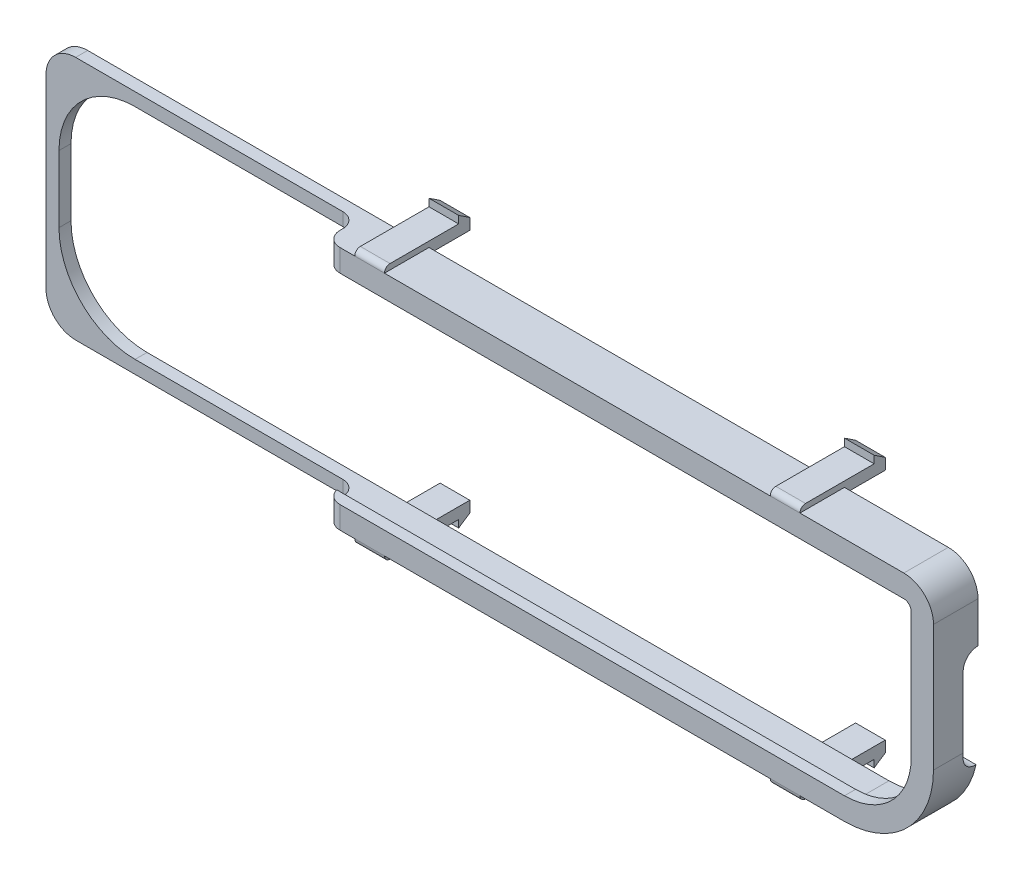
from build123d import *

# Parameters (mm, degrees)
BOSS_EXTRUDE2_THICKNESS_OF_TC_PCB_DEPTH = 4.5
BOSS_EXTRUDE3_RETAINING_TOP_DEPTH       = 1.5
CUT_EXTRUDE1_START                      = -2.881
CUT_EXTRUDE1_EXPOSED_TC_FRONT_DEPTH     = 2.881
FILLET1_R                               = 2
SKETCH7_W                               = 2
SKETCH7_H                               = 14
CUT_EXTRUDE1_USBC_CUTOUT_DEPTH          = 5
FILLET3_R                               = 2
SKETCH8_W                               = 4
SKETCH8_H                               = 1.5
BOSS_EXTRUDE5_SNAP_POSTS_DEPTH          = 5.5
BOSS_EXTRUDE6_SNAP_NOTCH_1_DEPTH        = 4
BOSS_EXTRUDE7_SNAP_NOTCH_2_DEPTH        = 4
SKETCH11_W                              = 4
SKETCH11_H                              = 2.5
BOSS_EXTRUDE1_SNAP_BUMPS_DEPTH          = 6
FILLET6_R                               = 1
FILLET7_R                               = 0.75
BOSS_EXTRUDE1_START                     = -1.619
BOSS_EXTRUDE1_DEPTH                     = 1.619
FILLET8_R                               = 4


with BuildPart() as part:
    # Sketch3 → Boss-Extrude2 - thickness of TC + PCB (new body)
    with BuildSketch(Plane.XY):
        with BuildLine():
            Line((122, -4.5), (122, 12.5))
            ThreePointArc((122, 12.5), (120.828427125, 15.328427125), (118, 16.5))
            Line((118, 16.5), (10, 16.5))
            ThreePointArc((10, 16.5), (1.514718626, 12.985281374), (-2, 4.5))
            Line((-2, 4.5), (-2, -4.5))
            ThreePointArc((-2, -4.5), (1.514718626, -12.985281374), (10, -16.5))
            Line((10, -16.5), (110, -16.5))
            ThreePointArc((110, -16.5), (118.485281374, -12.985281374), (122, -4.5))
        make_face()
        with BuildLine():
            Line((118, 14.75), (10, 14.75))
            ThreePointArc((10, 14.75), (2.752155493, 11.747844507), (-0.25, 4.5))
            Line((-0.25, 4.5), (-0.25, -4.5))
            ThreePointArc((-0.25, -4.5), (2.752155493, -11.747844507), (10, -14.75))
            Line((10, -14.75), (110, -14.75))
            ThreePointArc((110, -14.75), (117.247844507, -11.747844507), (120.25, -4.5))
            Line((120.25, -4.5), (120.25, 12.5))
            ThreePointArc((120.25, 12.5), (119.590990258, 14.090990258), (118, 14.75))
        make_face(mode=Mode.SUBTRACT)
    extrude(amount=BOSS_EXTRUDE2_THICKNESS_OF_TC_PCB_DEPTH)

    # Sketch4 → Boss-Extrude3 - retaining top (add)
    with BuildSketch(Plane.XY.offset(4.5)):
        with BuildLine():
            Line((40, 13.5), (118, 13.5))
            ThreePointArc((118, 13.5), (118.707106781, 13.207106781), (119, 12.5))
            Line((119, 12.5), (119, -4.5))
            ThreePointArc((119, -4.5), (116.363961031, -10.863961031), (110, -13.5))
            Line((110, -13.5), (40, -13.5))
            Line((40, -13.5), (40, -16.5))
            Line((40, -16.5), (110, -16.5))
            ThreePointArc((110, -16.5), (118.485281374, -12.985281374), (122, -4.5))
            Line((122, -4.5), (122, 12.5))
            ThreePointArc((122, 12.5), (120.828427125, 15.328427125), (118, 16.5))
            Line((118, 16.5), (40, 16.5))
            Line((40, 16.5), (40, 13.5))
        make_face()
    extrude(amount=BOSS_EXTRUDE3_RETAINING_TOP_DEPTH)

    # Sketch5 → Cut-Extrude1 - exposed TC front (cut)
    with BuildSketch(Plane.XY.offset(4.5).offset(CUT_EXTRUDE1_START)):
        with BuildLine():
            Line((40, -16.5), (40, -14.75))
            Line((40, -14.75), (10, -14.75))
            ThreePointArc((10, -14.75), (2.752155493, -11.747844507), (-0.25, -4.5))
            Line((-0.25, -4.5), (-0.25, 4.5))
            ThreePointArc((-0.25, 4.5), (2.752155493, 11.747844507), (10, 14.75))
            Line((10, 14.75), (40, 14.75))
            Line((40, 14.75), (40, 16.5))
            Line((40, 16.5), (10, 16.5))
            ThreePointArc((10, 16.5), (1.514718626, 12.985281374), (-2, 4.5))
            Line((-2, 4.5), (-2, -4.5))
            ThreePointArc((-2, -4.5), (1.514718626, -12.985281374), (10, -16.5))
            Line((10, -16.5), (40, -16.5))
        make_face()
    extrude(amount=CUT_EXTRUDE1_EXPOSED_TC_FRONT_DEPTH, mode=Mode.SUBTRACT)

    # Fillet1
    fillet1_edges = [part.edges().sort_by_distance(p)[0] for p in [
        (40, 15, 6),
        (40, 15.625, 1.619),
        (40, -15, 6),
        (40, -15.625, 1.619),
    ]]
    fillet(fillet1_edges, radius=FILLET1_R)

    # Sketch7 → Cut-Extrude1 - USBC cutout (cut)
    with BuildSketch(Plane(origin=(122, 0, 0), x_dir=(0, 0, -1), z_dir=(1, 0, 0))):
        with Locations((-1, 0)):
            Rectangle(SKETCH7_W, SKETCH7_H)
    extrude(amount=-CUT_EXTRUDE1_USBC_CUTOUT_DEPTH, mode=Mode.SUBTRACT)

    # Fillet3
    fillet3_edges = [part.edges().sort_by_distance(p)[0] for p in [
        (121.125, 7, 2),
        (120.838571135, -7, 2),
    ]]
    fillet(fillet3_edges, radius=FILLET3_R - 0.0001)  # a hair under: the kernel refuses the full size

    # Sketch8 → Boss-Extrude5 - snap posts (add)
    with BuildSketch(Plane(origin=(0, 0, 0), x_dir=(-1, 0, 0), z_dir=(0, 0, -1))):
        with Locations((-46, -16.5)):
            Rectangle(SKETCH8_W, SKETCH8_H)
        with Locations((-102, -16.5)):
            Rectangle(SKETCH8_W, SKETCH8_H)
    boss_extrude5_snap_posts = extrude(amount=BOSS_EXTRUDE5_SNAP_POSTS_DEPTH)

    # Sketch9 → Boss-Extrude6 - snap notch 1 (add)
    with BuildSketch(Plane.ZY.offset(-44)):
        Polygon((-5.5, -17.25), (-4, -18.25), (-4, -17.25), align=None)
    boss_extrude6_snap_notch_1 = extrude(amount=-BOSS_EXTRUDE6_SNAP_NOTCH_1_DEPTH)

    # Sketch10 → Boss-Extrude7 - snap notch 2 (add)
    with BuildSketch(Plane.ZY.offset(-100)):
        Polygon((-4, -18.25), (-4, -17.25), (-5.5, -17.25), align=None)
    boss_extrude7_snap_notch_2 = extrude(amount=-BOSS_EXTRUDE7_SNAP_NOTCH_2_DEPTH)

    # Sketch11 → Boss-Extrude1 - snap bumps (add)
    with BuildSketch(Plane(origin=(0, 0, 0), x_dir=(-1, 0, 0), z_dir=(0, 0, -1))):
        with Locations((-46, -16)):
            Rectangle(SKETCH11_W, SKETCH11_H)
        with Locations((-102, -16)):
            Rectangle(SKETCH11_W, SKETCH11_H)
    boss_extrude1_snap_bumps = extrude(amount=-BOSS_EXTRUDE1_SNAP_BUMPS_DEPTH)

    # Mirror1: Boss-Extrude5 - snap posts, Boss-Extrude6 - snap notch 1, Boss-Extrude7 - snap notch 2, Boss-Extrude1 - snap bumps across plane
    add(boss_extrude5_snap_posts.mirror(Plane.ZX))
    add(boss_extrude6_snap_notch_1.mirror(Plane.ZX))
    add(boss_extrude7_snap_notch_2.mirror(Plane.ZX))
    add(boss_extrude1_snap_bumps.mirror(Plane.ZX))

    # Fillet6
    fillet6_edges = [part.edges().sort_by_distance(p)[0] for p in [
        (46, -15.75, 0),
        (102, -15.75, 0),
        (46, 15.75, 0),
        (102, 15.75, 0),
    ]]
    fillet(fillet6_edges, radius=FILLET6_R - 0.0001)  # a hair under: the kernel refuses the full size

    # Fillet7
    fillet7_edges = [part.edges().sort_by_distance(p)[0] for p in [
        (46, -17.25, 6),
        (102, -17.25, 6),
        (46, 17.25, 6),
        (102, 17.25, 6),
    ]]
    fillet(fillet7_edges, radius=FILLET7_R)

    # Sketch13 → Boss-Extrude1 (add)
    with BuildSketch(Plane.XY.offset(1.619).offset(BOSS_EXTRUDE1_START)):
        with BuildLine():
            Line((-2, 4.5), (-2, 16.5))
            Line((-2, 16.5), (10, 16.5))
            ThreePointArc((10, 16.5), (1.514718626, 12.985281374), (-2, 4.5))
        make_face()
        with BuildLine():
            Line((-2, -4.5), (-2, -16.5))
            Line((-2, -16.5), (10, -16.5))
            ThreePointArc((10, -16.5), (1.514718626, -12.985281374), (-2, -4.5))
        make_face()
    extrude(amount=BOSS_EXTRUDE1_DEPTH)

    # Fillet8
    fillet8_edges = [part.edges().sort_by_distance(p)[0] for p in [
        (-2, 16.5, 0.8095),
        (-2, -16.5, 0.8095),
    ]]
    fillet(fillet8_edges, radius=FILLET8_R)


solid = part.part
